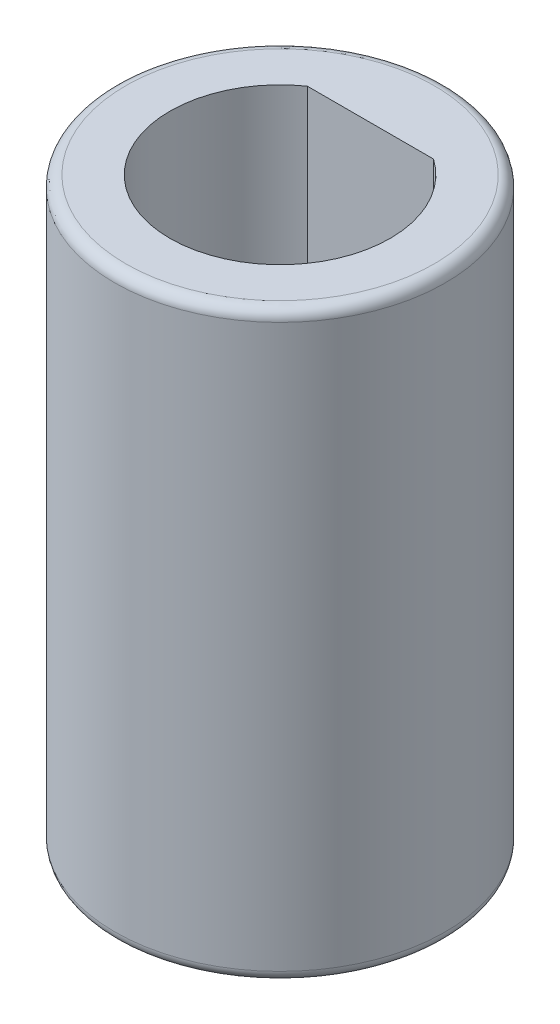
from build123d import *

# Parameters (mm, degrees)
SKETCH_1_R          = 1.5
EXTRUDE_1_DEPTH     = 5.3
CUT_EXTRUDE_1_REACH = 7.709
SKETCH_3_R          = 1.1
CUT_EXTRUDE_2_DEPTH = 1.75
FILLET_1_R          = 0.1
CHAMFER_1_SIZE      = 0.1


with BuildPart() as part:
    # 草图1 → 凸台-拉伸1 (new body)
    with BuildSketch(Plane(origin=(0, 0, 0), x_dir=(1, 0, 0), z_dir=(0, 1, 0))):
        with Locations(Location((0, 0, 0), (0, 0, 270))):
            Circle(SKETCH_1_R)
    extrude(amount=EXTRUDE_1_DEPTH)

    # 草图2 → 切除-拉伸1 (cut, up to next)
    with BuildSketch(Plane(origin=(0, 5.3, 0), x_dir=(1, 0, 0), z_dir=(0, 1, 0)), mode=Mode.PRIVATE) as cut_extrude_1_sk1:
        with BuildLine():
            Line((-0.572363521, 0.82), (0.572363521, 0.82))
            ThreePointArc((0.572363521, 0.82), (0, -1), (-0.572363521, 0.82))
        make_face()
    cut_extrude_1_tool1 = extrude(cut_extrude_1_sk1.sketch, amount=-CUT_EXTRUDE_1_REACH, mode=Mode.PRIVATE) & part.part
    add(cut_extrude_1_tool1.solids().sort_by_distance((0, 5.3, 0.041647))[0], mode=Mode.SUBTRACT)

    # 草图3 → 切除-拉伸2 (cut)
    with BuildSketch(Plane(origin=(0, 0, 0), x_dir=(-1, 0, 0), z_dir=(0, -1, 0))):
        with Locations(Location((0, 0, 0), (0, 0, 90))):
            Circle(SKETCH_3_R)
    extrude(amount=-CUT_EXTRUDE_2_DEPTH, mode=Mode.SUBTRACT)

    # 圆角1
    fillet_1_edges = [part.edges().sort_by_distance(p)[0] for p in [
        (0, 0, 1.1),
        (0, 0, -1.5),
        (0, 5.3, -1.5),
    ]]
    fillet(fillet_1_edges, radius=FILLET_1_R)

    # 倒角1
    chamfer_1_edges = [part.edges().sort_by_distance(p)[0] for p in [
        (0, 1.75, -0.82),
        (0, 1.75, 1),
    ]]
    chamfer(chamfer_1_edges, length=CHAMFER_1_SIZE - 0.0001)  # a hair under: the kernel refuses the full size


solid = part.part
